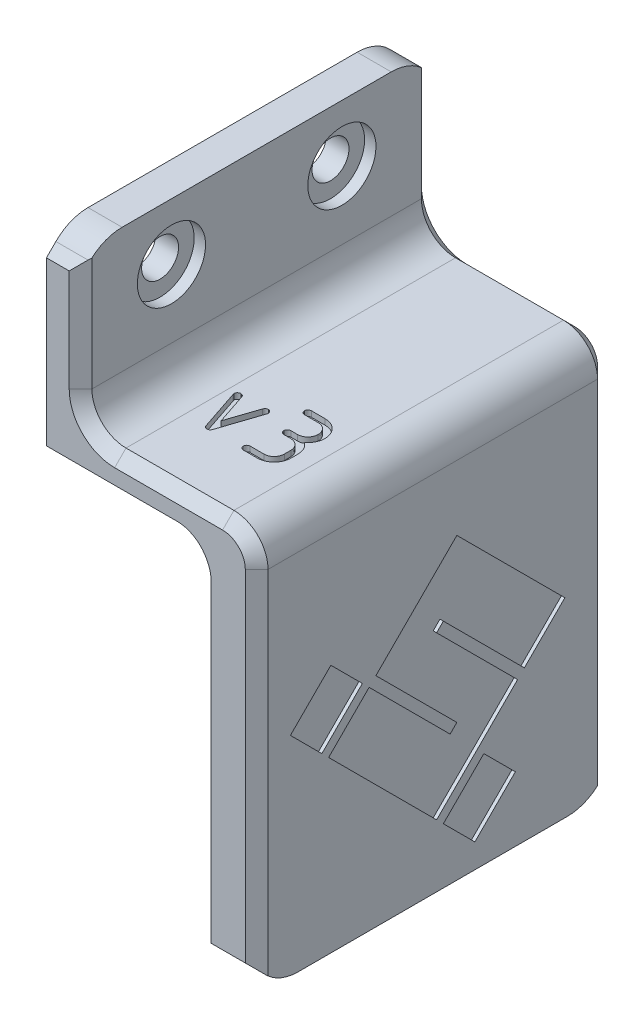
from build123d import *

# Parameters (mm, degrees)
BOSSMAIN_DEPTH                = 15.5
SKETCH2_R                     = 0.75
ENCODERHOLES_DEPTH            = 3.6
SKETCH3_R                     = 1.625
CUT_MOUNTING_HOLES_M2_5_DEPTH = 43.148546831
BOSSCURVE_DEPTH               = 14.5
FILLETBODY_R                  = 3
CHAMF_SHOULDER_BOTTOM_SIZE    = 3.925706831
CHAMFER1_SIZE                 = 3.663993043
FILLETINSIDE_R                = 3
CHAMFERSHOULDERS_SIZE         = 2
FILLET3_R                     = 10
SKETCH9_W                     = 12
SKETCH9_H                     = 1.25
SKETCH9_H_2                   = 1.7
BOSS_DATUM_BUMPS_DEPTH        = 1
VERSION_2_DEPTH               = 0.5
CHAMFERMAIN_SIZE              = 1
CHAMFER_DATUMS_SIZE           = 1
CHAMFERENCODER_SIZE           = 0.6
CUT_LOGO_DEPTH                = 0.3
FILLET4_R                     = 4
SKETCH13_R                    = 3
COUNTERBOREMTHOLES_DEPTH      = 1


# Some blends are built 0.0001 mm under size
with BuildPart() as part:
    # Sketch1 → bossMain (new, symmetric)
    with BuildSketch(Plane.XY):
        Polygon((0, 18), (0, 36), (3, 36), (3, 22), (18.5, 22), (18.5, -13), (14.5, -13), (14.5, 18), align=None)
    extrude(amount=BOSSMAIN_DEPTH, both=True)

    # Sketch2 → encoderHoles (cut)
    with BuildSketch(Plane.ZY.offset(-14.5)):
        with Locations((5.58, 9.075)):
            Circle(SKETCH2_R)
        with Locations((-5.58, -9.075)):
            Circle(SKETCH2_R)
    extrude(amount=-ENCODERHOLES_DEPTH, mode=Mode.SUBTRACT)

    # Sketch3 → cut mounting holes M2.5 (cut, through all)
    with BuildSketch(Plane(origin=(3, 0, 0), x_dir=(0, 0, -1), z_dir=(1, 0, 0))):
        with Locations(Location((-7.5, 31, 0), (0, 0, 90))):
            Circle(SKETCH3_R)
        with Locations(Location((7.5, 31, 0), (0, 0, 90))):
            Circle(SKETCH3_R)
    extrude(amount=-CUT_MOUNTING_HOLES_M2_5_DEPTH, mode=Mode.SUBTRACT)

    # Sketch4 → bossCurve (add)
    with BuildSketch(Plane.ZY):
        with BuildLine():
            Line((-15.5, 18), (-15.5, 16))
            ThreePointArc((-15.5, 16), (0, 17.737638482), (15.5, 16))
            Line((15.5, 16), (15.5, 18))
            Line((15.5, 18), (-15.5, 18))
        make_face()
    extrude(amount=-BOSSCURVE_DEPTH)

    # filletBody
    filletbody_edges = [part.edges().sort_by_distance(p)[0] for p in [
        (3, 22, 0),
        (18.5, 22, 0),
    ]]
    fillet(filletbody_edges, radius=FILLETBODY_R)

    # chamf_Shoulder_bottom
    # the kernel refuses this chamfer: 7.5, 3.925706831 mm, written as the material it takes off along each edge
    with BuildSketch(Plane(origin=(-21.635567756, 16, -15.5), x_dir=(0, 1, 0), z_dir=(1, 0, 0))) as chamf_shoulder_bottom_piece_1:
        with BuildLine():
            Line((CHAMF_SHOULDER_BOTTOM_SIZE, 0), (1.363595956, 8.273240985))
            ThreePointArc((1.363595956, 8.273240985), (0.827535181, 4.248947863), (0, 0))
            Line((0, 0), (CHAMF_SHOULDER_BOTTOM_SIZE, 0))
        make_face()
    extrude(amount=36.135567756, mode=Mode.SUBTRACT)

    # Chamfer1
    # the kernel refuses this chamfer: 7, 3.663993043 mm, written as the material it takes off along each edge
    with BuildSketch(Plane(origin=(-20.017614844, 16, 15.5), x_dir=(0, 0.16706247101394783, -0.9859463123206628), z_dir=(1, 0, 0))) as chamfer1_piece_1:
        with BuildLine():
            Line((7.756178097, 0), (CHAMFER1_SIZE * 0.167062470998, CHAMFER1_SIZE * 0.985946312225))
            Line((CHAMFER1_SIZE * 0.167062470998, CHAMFER1_SIZE * 0.985946312225), (0, 0))
            ThreePointArc((0, 0), (4.003329663, 0.107396053), (7.756178097, 0))
        make_face()
    extrude(amount=34.517614844, mode=Mode.SUBTRACT)

    # filletInside
    filletinside_edges = [part.edges().sort_by_distance(p)[0] for p in [
        (14.5, 17.736930337, 0.31486475),
        (14.5, 18.644651393, -11.363379507),
        (14.5, 18.479879661, 11.676412404),
    ]]
    fillet(filletinside_edges, radius=FILLETINSIDE_R)

    # chamferShoulders
    chamfershoulders_edges = [part.edges().sort_by_distance(p)[0] for p in [
        (1.5, 36, -15.5),
        (16.5, -13, 15.5),
        (1.5, 36, 15.5),
        (16.5, -13, -15.5),
    ]]
    chamfer(chamfershoulders_edges, length=CHAMFERSHOULDERS_SIZE)

    # Fillet3
    fillet3_edges = [part.edges().sort_by_distance(p)[0] for p in [
        (5.75, 17.363595956, -7.226759015),
        (5.75, 17.295766279, 7.852824807),
        (13.633077719, 16.389786703, 7.937580277),
        (13.632568228, 16.459379971, -7.315468148),
    ]]
    fillet(fillet3_edges, radius=FILLET3_R)

    # Sketch9 → boss datum bumps (add)
    with BuildSketch(Plane.ZY.offset(-14.5)):
        with Locations((0, 11.925)):
            Rectangle(SKETCH9_W, SKETCH9_H)
        with Locations((0, -12.15)):
            Rectangle(SKETCH9_W, SKETCH9_H_2)
    extrude(amount=BOSS_DATUM_BUMPS_DEPTH)

    # Sketch11 → version 2 (cut)
    with BuildSketch(Plane(origin=(0, 22, 0), x_dir=(1, 0, 0), z_dir=(0, 1, 0))):
        with BuildLine():
            add(Edge.make_bspline(
                [(6.598487519, -5.584865663), (6.600733961, -5.604295768), (6.605084559, -5.641925322), (6.617274901, -5.677780618), (6.623170732, -5.695121951)],
                knots=[0, 0, 0, 0, 1.032704525, 2, 2, 2, 2], degree=3))
            Line((6.623170732, -5.695121951), (7.820750762, -9.27648509))
            add(Edge.make_bspline(
                [(7.820750762, -9.27648509), (7.833841271, -9.30789855), (7.858758134, -9.367691862), (7.926718498, -9.436414851), (8.010442458, -9.483520924), (8.074157847, -9.491953119), (8.107317073, -9.496341463)],
                knots=[0, 0, 0, 0, 1.054683453, 2.007515722, 2.96305683, 4, 4, 4, 4], degree=3))
            add(Edge.make_bspline(
                [(8.107317073, -9.496341463), (8.142080484, -9.492026061), (8.208123779, -9.483827687), (8.294879413, -9.437212007), (8.363050783, -9.367675055), (8.388085558, -9.308089528), (8.401219512, -9.276829268)],
                knots=[0, 0, 0, 0, 1.06836729, 2.029677035, 2.966312611, 4, 4, 4, 4], degree=3))
            Line((8.401219512, -9.276829268), (9.599354516, -5.694184689))
            add(Edge.make_bspline(
                [(9.599354516, -5.694184689), (9.603798031, -5.677105546), (9.613082956, -5.641417907), (9.614904077, -5.604576142), (9.615853659, -5.585365854)],
                knots=[0, 0, 0, 0, 0.957146177, 2, 2, 2, 2], degree=3))
            add(Edge.make_bspline(
                [(9.615853659, -5.585365854), (9.614230276, -5.565295583), (9.611088492, -5.526452945), (9.592788095, -5.471225807), (9.56637141, -5.420299891), (9.527854992, -5.376818457), (9.482578966, -5.34010539), (9.431470999, -5.311121378), (9.373187432, -5.29556053), (9.333005446, -5.292057914), (9.312195122, -5.290243902)],
                knots=[0, 0, 0, 0, 1.027789528, 1.989114056, 2.957849911, 3.946954469, 4.938684973, 5.935646619, 6.930867606, 8, 8, 8, 8], degree=3))
            add(Edge.make_bspline(
                [(9.312195122, -5.290243902), (9.27911725, -5.294763663), (9.215750239, -5.303422132), (9.130806258, -5.348700331), (9.064161038, -5.418897605), (9.03883555, -5.478585262), (9.025609756, -5.509756098)],
                knots=[0, 0, 0, 0, 1.03692919, 1.986436811, 2.948451835, 4, 4, 4, 4], degree=3))
            Line((9.025609756, -5.509756098), (8.107350419, -8.242158918))
            Line((8.107350419, -8.242158918), (7.196975038, -5.50918326))
            add(Edge.make_bspline(
                [(7.196975038, -5.50918326), (7.183523362, -5.478195042), (7.157625244, -5.418534329), (7.089614042, -5.348247255), (7.001654389, -5.303073446), (6.935919459, -5.294676471), (6.901219512, -5.290243902)],
                knots=[0, 0, 0, 0, 1.028913269, 1.980936724, 2.934183284, 4, 4, 4, 4], degree=3))
            add(Edge.make_bspline(
                [(6.901219512, -5.290243902), (6.881220248, -5.292076376), (6.842244989, -5.295647563), (6.785245171, -5.311347063), (6.734349033, -5.340424361), (6.688008112, -5.376727956), (6.648432173, -5.420256963), (6.620412713, -5.470899614), (6.602400124, -5.52649028), (6.599209562, -5.565308303), (6.597560976, -5.585365854)],
                knots=[0, 0, 0, 0, 1.030543514, 2.008358934, 3.007991962, 4.018680577, 5.024181706, 6.005556065, 6.969456486, 8, 8, 8, 8], degree=3))
            Line((6.597560976, -5.585365854), (6.598487519, -5.584865663))
        make_face()
        with BuildLine():
            add(Edge.make_bspline(
                [(12.521423638, -6.525410871), (12.58332487, -6.529717556), (12.703626658, -6.538087371), (12.875453996, -6.588300852), (13.03034158, -6.668288791), (13.16449764, -6.777921265), (13.276496017, -6.909106429), (13.357815572, -7.061441053), (13.411354343, -7.229876258), (13.419164939, -7.348776275), (13.423170732, -7.409756098)],
                knots=[0, 0, 0, 0, 1.058978584, 2.058069159, 3.037758071, 4.021657752, 5.003688209, 5.968206507, 6.9579614, 8, 8, 8, 8], degree=3))
            Line((13.423170732, -7.409756098), (13.423369617, -7.995693598))
            add(Edge.make_bspline(
                [(13.423369617, -7.995693598), (13.419309664, -8.056894819), (13.411407454, -8.176015627), (13.357601272, -8.344952377), (13.276260417, -8.498350714), (13.164548767, -8.631561155), (13.031149913, -8.744197242), (12.875147559, -8.823422178), (12.703673218, -8.87587062), (12.582916246, -8.883748247), (12.520731707, -8.887804878)],
                knots=[0, 0, 0, 0, 1.041256597, 2.026680567, 2.993073191, 3.981435433, 4.969797675, 5.945199709, 6.941868068, 8, 8, 8, 8], degree=3))
            Line((12.520731707, -8.887804878), (11.316019198, -8.887804878))
            add(Edge.make_bspline(
                [(11.316019198, -8.887804878), (11.295081764, -8.888948206), (11.254159971, -8.891182818), (11.196634818, -8.909417458), (11.143552002, -8.93464407), (11.099081623, -8.972159718), (11.060435206, -9.015370476), (11.033847781, -9.066686259), (11.01536654, -9.123148145), (11.013281351, -9.16325411), (11.012195122, -9.184146341)],
                knots=[0, 0, 0, 0, 1.060955747, 2.073616602, 3.043257174, 4.026868974, 5.007876325, 5.968681719, 6.941833903, 8, 8, 8, 8], degree=3))
            add(Edge.make_bspline(
                [(11.012195122, -9.184146341), (11.013370406, -9.205015303), (11.015670433, -9.24585578), (11.033563616, -9.303682343), (11.060412513, -9.356507249), (11.09901494, -9.40098506), (11.143492751, -9.439587487), (11.196317657, -9.466436384), (11.25414422, -9.484329567), (11.294984697, -9.486629594), (11.315853659, -9.487804878)],
                knots=[0, 0, 0, 0, 1.045974665, 2.046968367, 3.014737927, 4, 4.985262073, 5.953031633, 6.954025335, 8, 8, 8, 8], degree=3))
            Line((11.315853659, -9.487804878), (12.521423638, -9.487804878))
            add(Edge.make_bspline(
                [(12.521423638, -9.487804878), (12.573718375, -9.485553714), (12.676591789, -9.481125258), (12.827459858, -9.457358615), (12.971503204, -9.420808588), (13.108810389, -9.372009482), (13.238947132, -9.310441957), (13.36296501, -9.236973711), (13.480482079, -9.15020472), (13.588971798, -9.050369626), (13.689174515, -8.942374482), (13.777125719, -8.826442432), (13.852042935, -8.703933645), (13.913421645, -8.574654801), (13.962075627, -8.438953318), (13.998850745, -8.297004307), (14.022553694, -8.148727049), (14.027007585, -8.047647477), (14.029268293, -7.996341463)],
                knots=[0, 0, 0, 0, 1.066873082, 2.098736551, 3.10817358, 4.094186606, 5.065874226, 6.03985819, 7.029802135, 8.039239164, 9.0425632, 10.030839284, 11.001996208, 11.966191853, 12.944401058, 13.937776121, 14.953255501, 16, 16, 16, 16], degree=3))
            Line((14.029268293, -7.996341463), (14.030286538, -7.409213034))
            add(Edge.make_bspline(
                [(14.030286538, -7.409213034), (14.028160795, -7.350713329), (14.023947678, -7.234769811), (13.991921778, -7.064478749), (13.943540428, -6.899696485), (13.874686738, -6.742291226), (13.788891542, -6.593399962), (13.683391002, -6.45709025), (13.56277142, -6.331112248), (13.470087572, -6.259447594), (13.423170732, -6.223170732)],
                knots=[0, 0, 0, 0, 1.014332037, 2.010355889, 2.996594147, 3.98838943, 4.983888816, 5.969874884, 6.972344594, 8, 8, 8, 8], degree=3))
            add(Edge.make_bspline(
                [(13.423170732, -6.223170732), (13.470107238, -6.185661329), (13.562926048, -6.111484991), (13.683482311, -5.981839075), (13.788985711, -5.841864332), (13.874417329, -5.689604929), (13.943619227, -5.529547867), (13.99184372, -5.362309588), (14.024171362, -5.189861939), (14.027561396, -5.072504565), (14.029268293, -5.013414634)],
                knots=[0, 0, 0, 0, 1.026490339, 2.029925523, 3.018678281, 4.018251485, 5.008860598, 5.994552535, 6.99024878, 8, 8, 8, 8], degree=3))
            add(Edge.make_bspline(
                [(14.029268293, -5.013414634), (14.027013091, -4.960889036), (14.022569003, -4.857382391), (13.998775195, -4.705496227), (13.96253697, -4.560530245), (13.913133774, -4.422644586), (13.852064872, -4.29126249), (13.777518577, -4.166435201), (13.689104928, -4.049203404), (13.589420847, -3.939851266), (13.480087507, -3.840125576), (13.363019734, -3.752103779), (13.239270779, -3.677207835), (13.108773884, -3.615861824), (12.971513301, -3.566977668), (12.827457051, -3.530452404), (12.676364729, -3.506638173), (12.573258132, -3.502240395), (12.520731707, -3.5)],
                knots=[0, 0, 0, 0, 1.062461703, 2.093680967, 3.102508552, 4.080142263, 5.051013382, 6.027990232, 7.014431632, 8.015290284, 9.016148936, 10.002590336, 10.97252138, 11.935951425, 12.913585136, 13.914443788, 14.937538297, 16, 16, 16, 16], degree=3))
            Line((12.520731707, -3.5), (11.316019198, -3.498982946))
            add(Edge.make_bspline(
                [(11.316019198, -3.498982946), (11.295103791, -3.500582372), (11.254259128, -3.503705812), (11.19631068, -3.521303444), (11.143494631, -3.548234919), (11.099014432, -3.586815083), (11.060412646, -3.63129887), (11.033563579, -3.684122195), (11.015670443, -3.741949189), (11.01337041, -3.782789606), (11.012195122, -3.803658537)],
                knots=[0, 0, 0, 0, 1.049928132, 2.050352754, 3.017572123, 4.002274059, 4.986975996, 5.954195365, 6.954619987, 8, 8, 8, 8], degree=3))
            add(Edge.make_bspline(
                [(11.012195122, -3.803658537), (11.013319879, -3.824541787), (11.015500008, -3.865020011), (11.033836237, -3.922296695), (11.060386703, -3.974807496), (11.099021911, -4.0192757), (11.143490923, -4.057880706), (11.196318159, -4.08472892), (11.254144086, -4.102622289), (11.294984652, -4.10492229), (11.315853659, -4.106097561)],
                knots=[0, 0, 0, 0, 1.048536336, 2.03238894, 3.002528642, 3.990203696, 4.97787875, 5.948018452, 6.951463664, 8, 8, 8, 8], degree=3))
            Line((11.315853659, -4.106097561), (12.521423638, -4.105899867))
            add(Edge.make_bspline(
                [(12.521423638, -4.105899867), (12.583401389, -4.109950885), (12.704083728, -4.11783898), (12.875241407, -4.171796871), (13.031247466, -4.252190942), (13.164570196, -4.366081014), (13.276657862, -4.500686457), (13.357832685, -4.656713974), (13.411477715, -4.829114747), (13.419198806, -4.950810993), (13.423170732, -5.013414634)],
                knots=[0, 0, 0, 0, 1.045582401, 2.035945591, 3.006428587, 3.990968025, 4.976416705, 5.9468997, 6.943833046, 8, 8, 8, 8], degree=3))
            add(Edge.make_bspline(
                [(13.423170732, -5.013414634), (13.419153739, -5.075194417), (13.41132069, -5.195663664), (13.357941571, -5.366596411), (13.27589389, -5.521531455), (13.165108241, -5.65717472), (13.030841155, -5.77067526), (12.875631923, -5.852955168), (12.703745425, -5.90628449), (12.582915039, -5.915017763), (12.520731707, -5.919512195)],
                knots=[0, 0, 0, 0, 1.044240831, 2.036247155, 3.002264277, 3.994675749, 4.98084866, 5.956171723, 6.948178046, 8, 8, 8, 8], degree=3))
            Line((12.520731707, -5.919512195), (11.922936119, -5.91849395))
            add(Edge.make_bspline(
                [(11.922936119, -5.91849395), (11.90172969, -5.920019789), (11.860964981, -5.922952879), (11.803305665, -5.94109037), (11.750805659, -5.96772103), (11.706327832, -6.006333749), (11.667750325, -6.050811496), (11.640802342, -6.103626403), (11.62328477, -6.161536827), (11.619982053, -6.202313221), (11.618292683, -6.223170732)],
                knots=[0, 0, 0, 0, 1.064044783, 2.045392747, 3.013062719, 3.998223403, 4.983384088, 5.95105406, 6.951944754, 8, 8, 8, 8], degree=3))
            add(Edge.make_bspline(
                [(11.618292683, -6.223170732), (11.619932289, -6.244042506), (11.623107143, -6.284457595), (11.641075678, -6.341816829), (11.667724375, -6.39431923), (11.706335319, -6.438781542), (11.750801928, -6.477418549), (11.80331315, -6.503968541), (11.860589721, -6.522304897), (11.90106796, -6.524485008), (11.92195122, -6.525609756)],
                knots=[0, 0, 0, 0, 1.0530203, 2.0390173, 3.01127151, 4.001099292, 4.990927074, 5.963181283, 6.949178283, 8, 8, 8, 8], degree=3))
            Line((11.92195122, -6.525609756), (12.521423638, -6.525410871))
        make_face()
    extrude(amount=-VERSION_2_DEPTH, mode=Mode.SUBTRACT)

    # chamferMain
    chamfermain_edges = [part.edges().sort_by_distance(p)[0] for p in [
        (18.5, 4, -15.5),
        (18.5, 4, 15.5),
        (3, 29.5, -15.5),
        (3, 29.5, 15.5),
        (10.75, 22, -15.5),
        (10.75, 22, 15.5),
        (17.621320344, 21.121320344, -15.5),
        (17.621320344, 21.121320344, 15.5),
        (3.878679656, 22.878679656, -15.5),
        (3.878679656, 22.878679656, 15.5),
    ]]
    chamfer(chamfermain_edges, length=CHAMFERMAIN_SIZE)

    # chamfer Datums
    chamfer_datums_edges = [part.edges().sort_by_distance(p)[0] for p in [
        (13.5, 11.925, -6),
        (13.5, 11.925, 6),
        (13.5, -12.15, -6),
        (13.5, -12.15, 6),
    ]]
    chamfer(chamfer_datums_edges, length=CHAMFER_DATUMS_SIZE - 0.0001)  # a hair under: the kernel refuses the full size

    # chamferEncoder
    chamferencoder_edges = [part.edges().sort_by_distance(p)[0] for p in [
        (14.5, 9.075, 4.83),
        (14.5, -9.075, -6.33),
    ]]
    chamfer(chamferencoder_edges, length=CHAMFERENCODER_SIZE)

    # Sketch12 → cut logo (cut)
    with BuildSketch(Plane(origin=(18.5, 0, 0), x_dir=(0, 0, -1), z_dir=(1, 0, 0))):
        Polygon((7.266474181, -7.308322307), (3.702656004, -10.872140484), (0.930797422, -8.100281902), (4.494615599, -4.536463725), align=None)
        Polygon((1.524767118, -1.566615244), (2.118736814, -0.972645548), (-5.00889954, 6.154990807), (2.118736814, 13.282627161), (11.622251953, 3.779112022), (8.058433776, 0.215293844), (0.930797422, 7.342930199), (0.336827726, 6.748960503), (7.46446408, -0.378675852), (0.336827726, -7.506312206), (-9.166687413, 1.997202933), (-5.602869236, 5.56102111), align=None)
        Polygon((-9.76065711, 2.591172629), (-12.532515692, 5.363031212), (-8.968697515, 8.926849389), (-6.196838932, 6.154990806), align=None)
    extrude(amount=-CUT_LOGO_DEPTH, mode=Mode.SUBTRACT)

    # Fillet4
    fillet4_edges = [part.edges().sort_by_distance(p)[0] for p in [
        (1.5, 36, -13.5),
        (1.5, 36, 13.5),
        (16.5, -13, 13.5),
        (16.5, -13, -13.5),
    ]]
    fillet(fillet4_edges, radius=FILLET4_R)

    # Sketch13 → counterBoreMtHoles (cut)
    with BuildSketch(Plane(origin=(3, 0, 0), x_dir=(0, 0, -1), z_dir=(1, 0, 0))):
        with Locations(Location((-7.5, 31, 0), (0, 0, 90))):
            Circle(SKETCH13_R)
        with Locations(Location((7.5, 31, 0), (0, 0, 90))):
            Circle(SKETCH13_R)
    extrude(amount=-COUNTERBOREMTHOLES_DEPTH, mode=Mode.SUBTRACT)


solid = part.part
